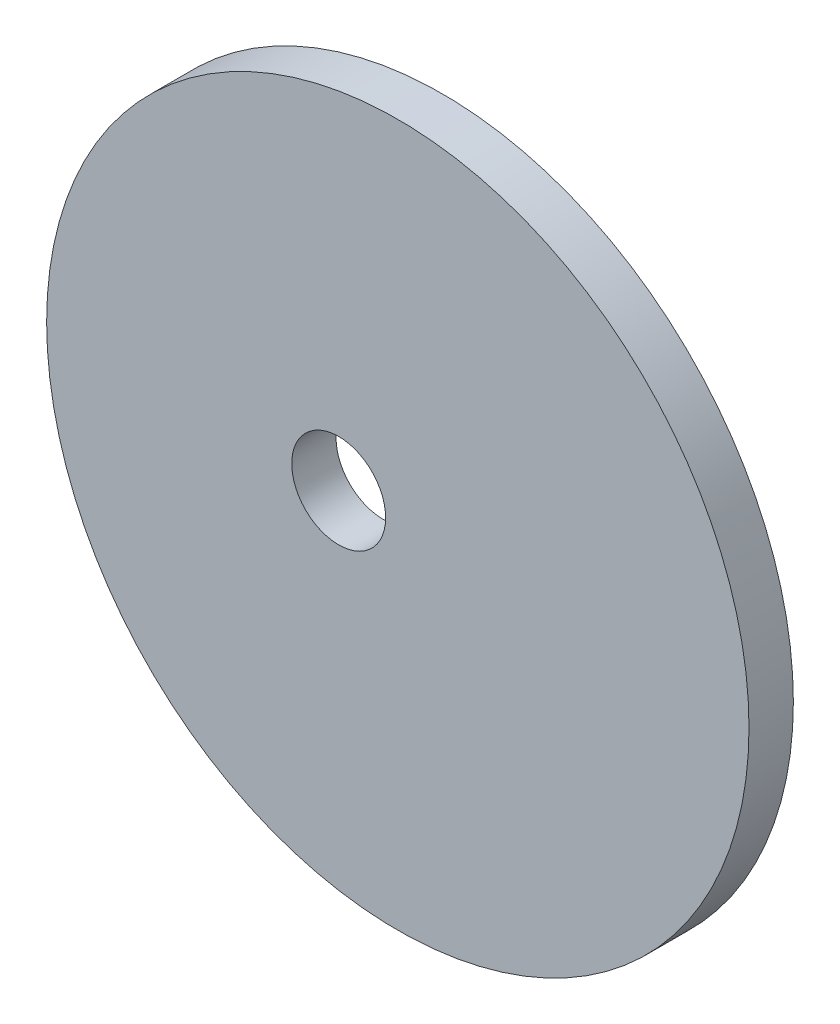
from build123d import *

# Parameters (mm, degrees)
SKETCH1_R           = 23.75
SKETCH1_R_2         = 3.175
BOSS_EXTRUDE5_DEPTH = 3


with BuildPart() as part:
    # Sketch1 → Boss-Extrude5 (new body)
    with BuildSketch(Plane.XY):
        Circle(SKETCH1_R)
        with Locations((-4, 0)):
            Circle(SKETCH1_R_2, mode=Mode.SUBTRACT)
    extrude(amount=BOSS_EXTRUDE5_DEPTH)


solid = part.part
